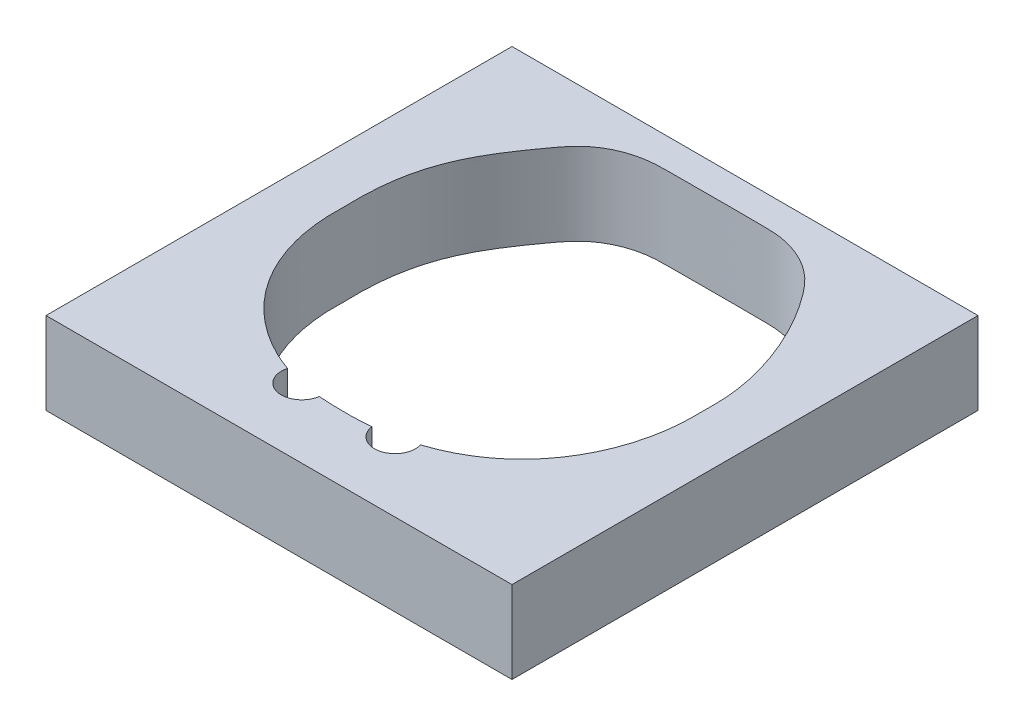
from build123d import *

# Parameters (mm, degrees)
ESQUISSE1_W             = 17
ESQUISSE1_H             = 17
BOSS_EXTRU_1_DEPTH      = 3
ESQUISSE3_R             = 0.75
ENL_V_MAT_EXTRU_1_DEPTH = 3


with BuildPart() as part:
    # Esquisse1 → Boss.-Extru.1 (new body)
    with BuildSketch(Plane(origin=(0, 0, 0), x_dir=(1, 0, 0), z_dir=(0, 1, 0))):
        with Locations((0, -0.5)):
            Rectangle(ESQUISSE1_W, ESQUISSE1_H)
        with BuildLine():
            add(Edge.make_bspline(
                [(-6.5, 0.021425618), (-6.565063138, 2.578432336), (-5.632782381, 4.102553172), (-3.903676203, 6.446852428), (-2.758160831, 6.899276222), (-0.878751888, 6.912168393), (1.130065999, 6.9136657), (2.762387867, 6.894575989), (3.913312434, 6.393724296), (5.683837223, 4.182928225), (6.55481217, 1.824257749), (6.494321325, -0.006355754), (6.512385425, -0.674969758), (6.245604325, -3.43668929), (4.325324504, -6.182451815), (0.542300843, -6.620044185), (-0.424881736, -6.607450435), (-3.091157441, -6.478339187), (-6.122763326, -4.404044401), (-6.516967238, -0.772884176), (-6.493763894, -0.201339557), (-6.499435316, -0.000766677), (-6.5, 0.021425618)],
                knots=[0, 0, 0, 0, 0.112371839, 0.130275732, 0.173620802, 0.187168536, 0.252205347, 0.266940035, 0.319780728, 0.343419676, 0.479690568, 0.498676785, 0.51429563, 0.54296722, 0.756721096, 0.785787005, 0.804560399, 0.825241089, 0.971913217, 0.99122251, 0.999024723, 1, 1, 1, 1], degree=3))
        make_face(mode=Mode.SUBTRACT)
    extrude(amount=BOSS_EXTRU_1_DEPTH)

    # Esquisse3 → Enlèv. mat.-Extru.1 (cut)
    with BuildSketch(Plane(origin=(0, 3, 0), x_dir=(1, 0, 0), z_dir=(0, 1, 0))):
        with Locations((-1.7, -6.467685331)):
            Circle(ESQUISSE3_R)
        with Locations((1.7, -6.467685331)):
            Circle(ESQUISSE3_R)
    extrude(amount=-ENL_V_MAT_EXTRU_1_DEPTH, mode=Mode.SUBTRACT)


solid = part.part
